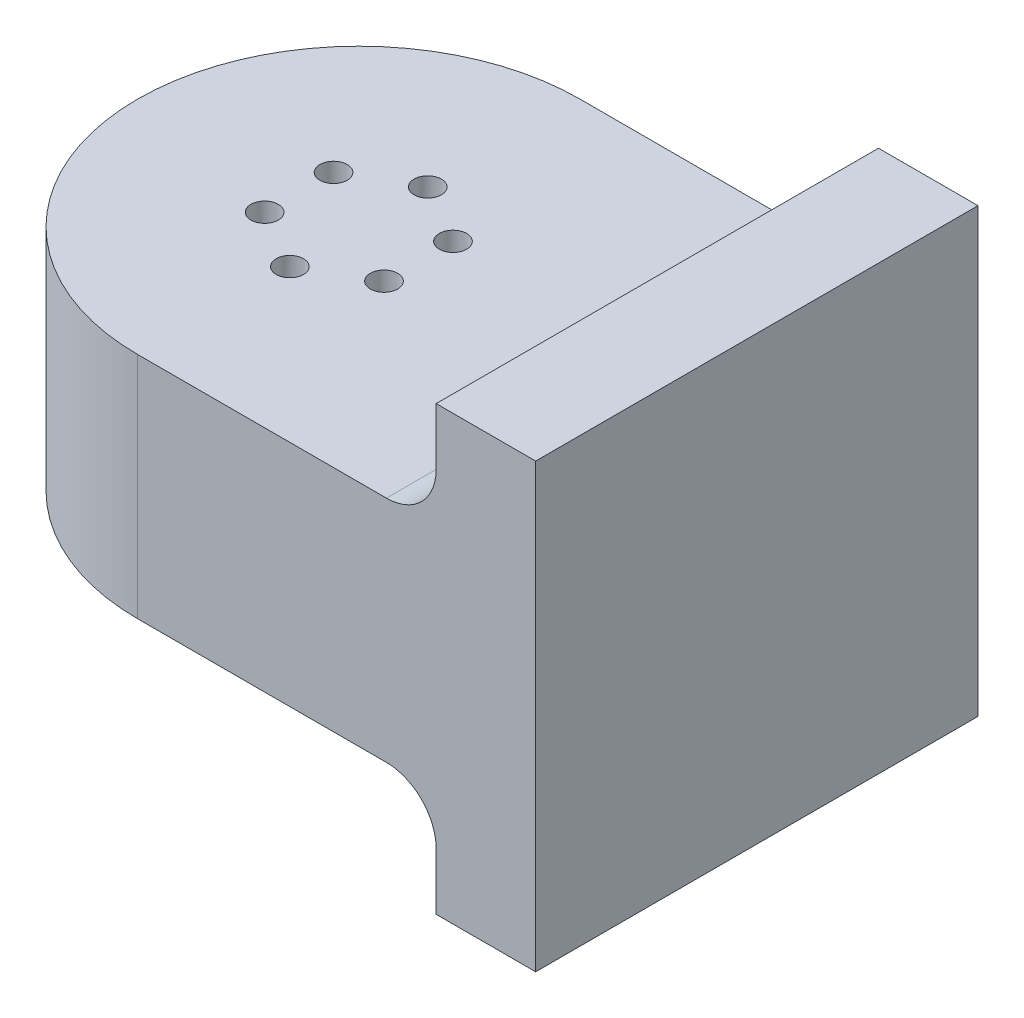
from build123d import *

# Parameters (mm, degrees)
BOSS_EXTRUDE1_DEPTH = 46
SKETCH2_R           = 2.75
CUT_EXTRUDE2_DEPTH  = 76
SKETCH3_W           = 88.9
SKETCH3_H           = 88.9
BOSS_EXTRUDE2_DEPTH = 20
FILLET1_R           = 10


with BuildPart() as part:
    # Sketch1 → Boss-Extrude1 (new body)
    with BuildSketch(Plane(origin=(0, 0, 0), x_dir=(1, 0, 0), z_dir=(0, 1, 0))):
        with BuildLine():
            Line((0, 44.45), (60, 44.45))
            Line((60, 44.45), (60, -44.45))
            Line((60, -44.45), (0, -44.45))
            ThreePointArc((0, -44.45), (-44.45, 0), (0, 44.45))
        make_face()
    extrude(amount=BOSS_EXTRUDE1_DEPTH)

    # Sketch2 → Cut-Extrude2 (cut)
    with BuildSketch(Plane(origin=(0, 0, 0), x_dir=(-1, 0, 0), z_dir=(0, -1, 0))):
        with Locations((0, -13.856406461)):
            Circle(SKETCH2_R)
        with Locations((12, -6.92820323)):
            Circle(SKETCH2_R)
        with Locations((-12, -6.92820323)):
            Circle(SKETCH2_R)
        with Locations((12, 6.92820323)):
            Circle(SKETCH2_R)
        with Locations((-12, 6.92820323)):
            Circle(SKETCH2_R)
        with Locations((0, 13.856406461)):
            Circle(SKETCH2_R)
    extrude(amount=-CUT_EXTRUDE2_DEPTH, mode=Mode.SUBTRACT)

    # Sketch3 → Boss-Extrude2 (add)
    with BuildSketch(Plane(origin=(60, 0, 0), x_dir=(0, 0, -1), z_dir=(1, 0, 0))):
        with Locations((0, 23)):
            Rectangle(SKETCH3_W, SKETCH3_H)
    extrude(amount=BOSS_EXTRUDE2_DEPTH)

    # Fillet1
    fillet1_edges = [part.edges().sort_by_distance(p)[0] for p in [
        (60, 46, 0),
        (60, 0, 0),
    ]]
    fillet(fillet1_edges, radius=FILLET1_R)


solid = part.part
